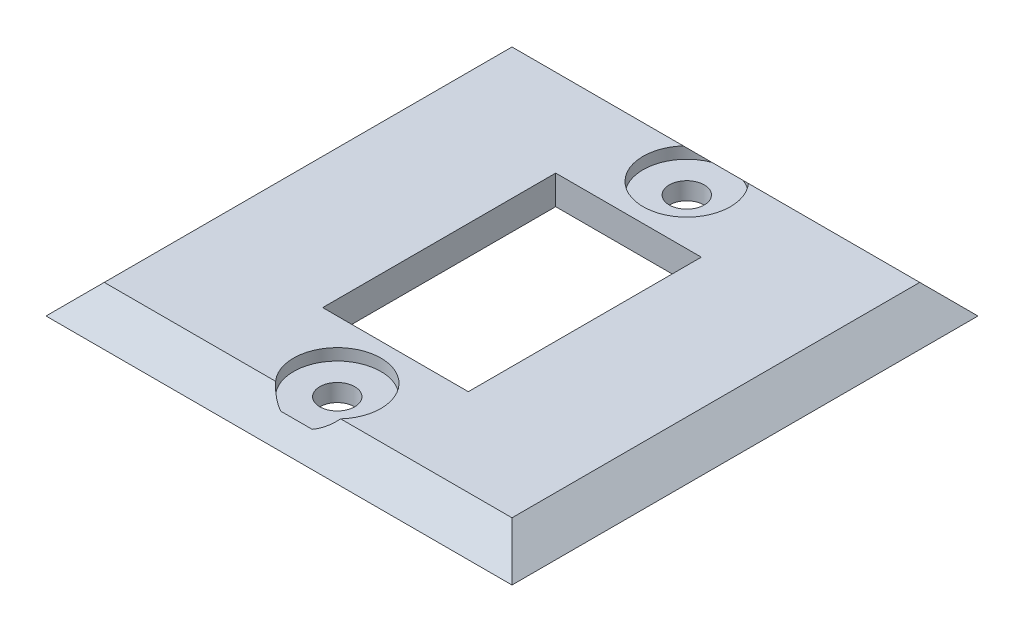
from build123d import *

# Parameters (mm, degrees)
SKETCH1_W           = 40
SKETCH1_H           = 40
SKETCH1_W_2         = 12.5
SKETCH1_H_2         = 20
BOSS_EXTRUDE1_DEPTH = 2.5
SKETCH2_R           = 1.5
CUT_EXTRUDE1_DEPTH  = 10
SKETCH3_R           = 3.75
CUT_EXTRUDE2_DEPTH  = 1
CHAMFER1_SIZE       = 2.5


with BuildPart() as part:
    # Sketch1 → Boss-Extrude1 (new body)
    with BuildSketch(Plane(origin=(0, 0, 0), x_dir=(1, 0, 0), z_dir=(0, 1, 0))):
        Rectangle(SKETCH1_W, SKETCH1_H)
        Rectangle(SKETCH1_W_2, SKETCH1_H_2, mode=Mode.SUBTRACT)
    extrude(amount=BOSS_EXTRUDE1_DEPTH)

    # Sketch2 → Cut-Extrude1 (cut)
    with BuildSketch(Plane(origin=(0, 2.5, 0), x_dir=(1, 0, 0), z_dir=(0, 1, 0))):
        with Locations(Location((0, 15, 0), (0, 0, 270))):
            Circle(SKETCH2_R)
        with Locations(Location((0, -15, 0), (0, 0, 270))):
            Circle(SKETCH2_R)
    extrude(amount=-CUT_EXTRUDE1_DEPTH, mode=Mode.SUBTRACT)

    # Sketch3 → Cut-Extrude2 (cut)
    with BuildSketch(Plane(origin=(0, 2.5, 0), x_dir=(1, 0, 0), z_dir=(0, 1, 0))):
        with Locations(Location((0, 15, 0), (0, 0, 270))):
            Circle(SKETCH3_R)
        with Locations(Location((0, -15, 0), (0, 0, 270))):
            Circle(SKETCH3_R)
    extrude(amount=-CUT_EXTRUDE2_DEPTH, mode=Mode.SUBTRACT)

    # Chamfer1
    # the kernel refuses this chamfer: 2.5 mm, written as the material it takes off along each edge
    with BuildSketch(Plane(origin=(20, 2.5, -26.42920747), x_dir=(0.027495876610586317, -0.9996219169112968, 0), z_dir=(0, 0, 1)), Plane(origin=(-26.42920747, 2.5, -20), x_dir=(0, -0.9996219169112968, -0.027495876610586317), z_dir=(1, 0, 0)), Plane(origin=(-20, 2.5, 26.42920747), x_dir=(-0.027495876610586317, -0.9996219169112968, 0), z_dir=(0, 0, -1))) as chamfer1_piece_1:
        Polygon((CHAMFER1_SIZE * 0.999621916911, -CHAMFER1_SIZE * 0.0274958766106), (-CHAMFER1_SIZE * 0.0274958766106, -CHAMFER1_SIZE * 0.999621916911), (0, 0), align=None)
    extrude(amount=52.85841494, mode=Mode.SUBTRACT)
    with BuildSketch(Plane(origin=(26.42920747, 2.5, 20), x_dir=(0, 0.027495876610586317, -0.9996219169112968), z_dir=(-1, 0, 0))) as chamfer1_piece_2:
        Polygon((CHAMFER1_SIZE * 0.999621916911, CHAMFER1_SIZE * 0.0274958766106), (-CHAMFER1_SIZE * 0.0274958766106, CHAMFER1_SIZE * 0.999621916911), (0, 0), align=None)
    extrude(amount=52.85841494, mode=Mode.SUBTRACT)


solid = part.part
